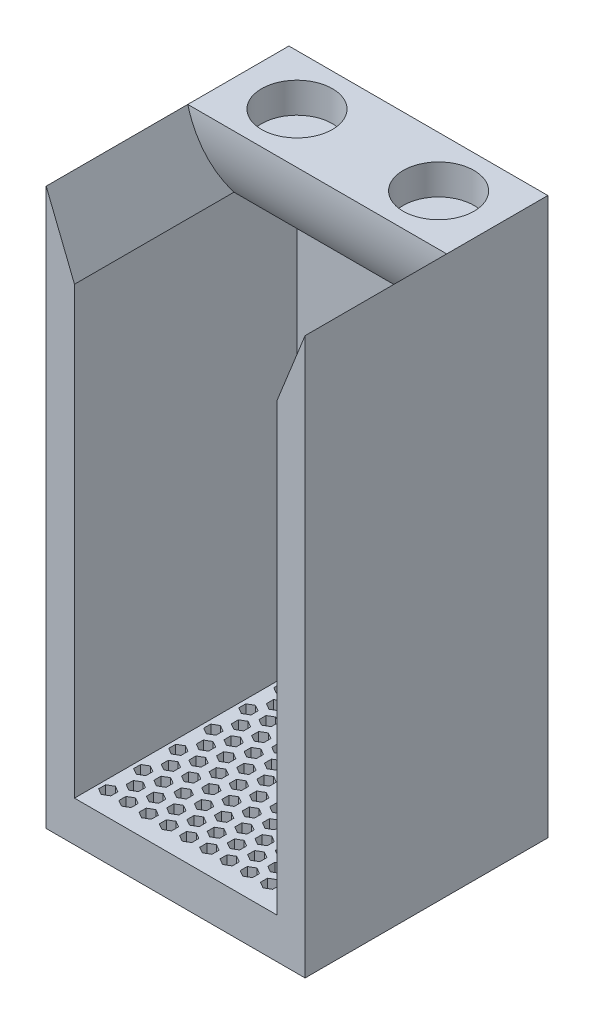
from build123d import *

# Parameters (mm, degrees)
SKETCH1_W               = 12.8
SKETCH1_H               = 27.5
BOSS_EXTRUDE1_DEPTH     = 12
SKETCH2_R               = 1.75
CUT_EXTRUDE1_DEPTH      = 1.5
SKETCH3_W               = 10
SKETCH3_H               = 22
CUT_EXTRUDE2_DEPTH      = 11
CUT_EXTRUDE3_REACH      = 31.703
CUT_EXTRUDE3_END_RADIUS = 5.3
FILL_START              = -18.5
FILL_PATTERN1_DEPTH     = 2


# Read off the part's stored shape, not the designer's step: Fill Pattern1
with BuildPart() as part:
    # Sketch1 → Boss-Extrude1 (new body)
    with BuildSketch(Plane.XY):
        with Locations((-13.5, -4.75)):
            Rectangle(SKETCH1_W, SKETCH1_H)
    extrude(amount=BOSS_EXTRUDE1_DEPTH)

    # Sketch2 → Cut-Extrude1 (cut)
    with BuildSketch(Plane(origin=(0, 9, 0), x_dir=(1, 0, 0), z_dir=(0, 1, 0))):
        with Locations(Location((-17, -2.5, 0), (0, 0, 270))):
            Circle(SKETCH2_R)
        with Locations(Location((-10, -2.5, 0), (0, 0, 270))):
            Circle(SKETCH2_R)
    extrude(amount=-CUT_EXTRUDE1_DEPTH, mode=Mode.SUBTRACT)

    # Sketch3 → Cut-Extrude2 (cut)
    with BuildSketch(Plane.XY.offset(12)):
        with Locations((-13.5, -5.5)):
            Rectangle(SKETCH3_W, SKETCH3_H)
    extrude(amount=-CUT_EXTRUDE2_DEPTH, mode=Mode.SUBTRACT)

    # Cut-Extrude3: up to this cylinder (the profile starts outside it)
    cut_extrude3_end = Plane(origin=(-13.5, 8.47159519, -0.273593496), z_dir=(1, 0, 0)) * Cylinder(CUT_EXTRUDE3_END_RADIUS, 75.006, mode=Mode.PRIVATE)
    # Sketch4 → Cut-Extrude3 (cut, up to the surface)
    with BuildSketch(Plane.XY.offset(12), mode=Mode.PRIVATE) as cut_extrude3_sk1:
        Polygon((-18.5, 5.5), (-19.9, 9), (-7.1, 9), (-8.5, 5.5), align=None)
    cut_extrude3_tool1 = extrude(cut_extrude3_sk1.sketch, amount=-CUT_EXTRUDE3_REACH, mode=Mode.PRIVATE) - cut_extrude3_end
    add(cut_extrude3_tool1.solids().sort_by_distance((-13.5, 7.321637, 12))[0], mode=Mode.SUBTRACT)

    # Fill Pattern1 outline → Fill Pattern1 (cut)
    with BuildSketch(Plane(origin=(0, 0, 0), x_dir=(1, 0, 0), z_dir=(0, 1, 0)).offset(FILL_START)):
        Polygon((-18, -11.180127019), (-17.696891109, -11.005127019), (-17.696891109, -10.655127019), (-18, -10.480127019), (-18.303108891, -10.655127019), (-18.303108891, -11.005127019), align=None)
        Polygon((-13.5, -8.582050808), (-13.196891109, -8.407050808), (-13.196891109, -8.057050808), (-13.5, -7.882050808), (-13.803108891, -8.057050808), (-13.803108891, -8.407050808), align=None)
        Polygon((-10.5, -6.85), (-10.196891109, -6.675), (-10.196891109, -6.325), (-10.5, -6.15), (-10.803108891, -6.325), (-10.803108891, -6.675), align=None)
        Polygon((-15, -9.448076211), (-14.696891109, -9.273076211), (-14.696891109, -8.923076211), (-15, -8.748076211), (-15.303108891, -8.923076211), (-15.303108891, -9.273076211), align=None)
        Polygon((-12, -7.716025404), (-11.696891109, -7.541025404), (-11.696891109, -7.191025404), (-12, -7.016025404), (-12.303108891, -7.191025404), (-12.303108891, -7.541025404), align=None)
        Polygon((-9, -5.983974596), (-8.696891109, -5.808974596), (-8.696891109, -5.458974596), (-9, -5.283974596), (-9.303108891, -5.458974596), (-9.303108891, -5.808974596), align=None)
        Polygon((-16.5, -10.314101615), (-16.196891109, -10.139101615), (-16.196891109, -9.789101615), (-16.5, -9.614101615), (-16.803108891, -9.789101615), (-16.803108891, -10.139101615), align=None)
        Polygon((-17.696891109, -9.273076211), (-17.696891109, -8.923076211), (-18, -8.748076211), (-18.303108891, -8.923076211), (-18.303108891, -9.273076211), (-18, -9.448076211), align=None)
        Polygon((-17.696891109, -7.541025404), (-17.696891109, -7.191025404), (-18, -7.016025404), (-18.303108891, -7.191025404), (-18.303108891, -7.541025404), (-18, -7.716025404), align=None)
        Polygon((-17.696891109, -5.808974596), (-17.696891109, -5.458974596), (-18, -5.283974596), (-18.303108891, -5.458974596), (-18.303108891, -5.808974596), (-18, -5.983974596), align=None)
        Polygon((-17.696891109, -4.076923789), (-17.696891109, -3.726923789), (-18, -3.551923789), (-18.303108891, -3.726923789), (-18.303108891, -4.076923789), (-18, -4.251923789), align=None)
        Polygon((-17.696891109, -2.344872981), (-17.696891109, -1.994872981), (-18, -1.819872981), (-18.303108891, -1.994872981), (-18.303108891, -2.344872981), (-18, -2.519872981), align=None)
        Polygon((-11.5, -8.582050808), (-11.196891109, -8.407050808), (-11.196891109, -8.057050808), (-11.5, -7.882050808), (-11.803108891, -8.057050808), (-11.803108891, -8.407050808), align=None)
        Polygon((-14.5, -10.314101615), (-14.196891109, -10.139101615), (-14.196891109, -9.789101615), (-14.5, -9.614101615), (-14.803108891, -9.789101615), (-14.803108891, -10.139101615), align=None)
        Polygon((-13, -9.448076211), (-12.696891109, -9.273076211), (-12.696891109, -8.923076211), (-13, -8.748076211), (-13.303108891, -8.923076211), (-13.303108891, -9.273076211), align=None)
        Polygon((-10, -7.716025404), (-9.696891109, -7.541025404), (-9.696891109, -7.191025404), (-10, -7.016025404), (-10.303108891, -7.191025404), (-10.303108891, -7.541025404), align=None)
        Polygon((-16, -11.180127019), (-15.696891109, -11.005127019), (-15.696891109, -10.655127019), (-16, -10.480127019), (-16.303108891, -10.655127019), (-16.303108891, -11.005127019), align=None)
        Polygon((-11.196891109, -6.675), (-11.196891109, -6.325), (-11.5, -6.15), (-11.803108891, -6.325), (-11.803108891, -6.675), (-11.5, -6.85), align=None)
        Polygon((-11.196891109, -10.139101615), (-11.196891109, -9.789101615), (-11.5, -9.614101615), (-11.803108891, -9.789101615), (-11.803108891, -10.139101615), (-11.5, -10.314101615), align=None)
        Polygon((-11.196891109, -3.210898385), (-11.196891109, -2.860898385), (-11.5, -2.685898385), (-11.803108891, -2.860898385), (-11.803108891, -3.210898385), (-11.5, -3.385898385), align=None)
        Polygon((-11.196891109, -4.942949192), (-11.196891109, -4.592949192), (-11.5, -4.417949192), (-11.803108891, -4.592949192), (-11.803108891, -4.942949192), (-11.5, -5.117949192), align=None)
        Polygon((-9.696891109, -8.923076211), (-10, -8.748076211), (-10.303108891, -8.923076211), (-10.303108891, -9.273076211), (-10, -9.448076211), (-9.696891109, -9.273076211), align=None)
        Polygon((-14.196891109, -6.325), (-14.5, -6.15), (-14.803108891, -6.325), (-14.803108891, -6.675), (-14.5, -6.85), (-14.196891109, -6.675), align=None)
        Polygon((-12.696891109, -7.191025404), (-13, -7.016025404), (-13.303108891, -7.191025404), (-13.303108891, -7.541025404), (-13, -7.716025404), (-12.696891109, -7.541025404), align=None)
        Polygon((-17.196891109, -4.592949192), (-17.5, -4.417949192), (-17.803108891, -4.592949192), (-17.803108891, -4.942949192), (-17.5, -5.117949192), (-17.196891109, -4.942949192), align=None)
        Polygon((-15.696891109, -5.458974596), (-16, -5.283974596), (-16.303108891, -5.458974596), (-16.303108891, -5.808974596), (-16, -5.983974596), (-15.696891109, -5.808974596), align=None)
        Polygon((-10.5, -8.582050808), (-10.196891109, -8.407050808), (-10.196891109, -8.057050808), (-10.5, -7.882050808), (-10.803108891, -8.057050808), (-10.803108891, -8.407050808), align=None)
        Polygon((-13.5, -10.314101615), (-13.196891109, -10.139101615), (-13.196891109, -9.789101615), (-13.5, -9.614101615), (-13.803108891, -9.789101615), (-13.803108891, -10.139101615), align=None)
        Polygon((-12, -9.448076211), (-11.696891109, -9.273076211), (-11.696891109, -8.923076211), (-12, -8.748076211), (-12.303108891, -8.923076211), (-12.303108891, -9.273076211), align=None)
        Polygon((-15, -11.180127019), (-14.696891109, -11.005127019), (-14.696891109, -10.655127019), (-15, -10.480127019), (-15.303108891, -10.655127019), (-15.303108891, -11.005127019), align=None)
        Polygon((-9, -7.716025404), (-8.696891109, -7.541025404), (-8.696891109, -7.191025404), (-9, -7.016025404), (-9.303108891, -7.191025404), (-9.303108891, -7.541025404), align=None)
        Polygon((-10.196891109, -10.139101615), (-10.196891109, -9.789101615), (-10.5, -9.614101615), (-10.803108891, -9.789101615), (-10.803108891, -10.139101615), (-10.5, -10.314101615), align=None)
        Polygon((-10.196891109, -3.210898385), (-10.196891109, -2.860898385), (-10.5, -2.685898385), (-10.803108891, -2.860898385), (-10.803108891, -3.210898385), (-10.5, -3.385898385), align=None)
        Polygon((-10.196891109, -4.942949192), (-10.196891109, -4.592949192), (-10.5, -4.417949192), (-10.803108891, -4.592949192), (-10.803108891, -4.942949192), (-10.5, -5.117949192), align=None)
        Polygon((-8.696891109, -8.923076211), (-9, -8.748076211), (-9.303108891, -8.923076211), (-9.303108891, -9.273076211), (-9, -9.448076211), (-8.696891109, -9.273076211), align=None)
        Polygon((-13.196891109, -6.325), (-13.5, -6.15), (-13.803108891, -6.325), (-13.803108891, -6.675), (-13.5, -6.85), (-13.196891109, -6.675), align=None)
        Polygon((-14.696891109, -5.458974596), (-15, -5.283974596), (-15.303108891, -5.458974596), (-15.303108891, -5.808974596), (-15, -5.983974596), (-14.696891109, -5.808974596), align=None)
        Polygon((-16.196891109, -4.592949192), (-16.5, -4.417949192), (-16.803108891, -4.592949192), (-16.803108891, -4.942949192), (-16.5, -5.117949192), (-16.196891109, -4.942949192), align=None)
        Polygon((-9.5, -8.582050808), (-9.196891109, -8.407050808), (-9.196891109, -8.057050808), (-9.5, -7.882050808), (-9.803108891, -8.057050808), (-9.803108891, -8.407050808), align=None)
        Polygon((-14, -11.180127019), (-13.696891109, -11.005127019), (-13.696891109, -10.655127019), (-14, -10.480127019), (-14.303108891, -10.655127019), (-14.303108891, -11.005127019), align=None)
        Polygon((-12.5, -10.314101615), (-12.196891109, -10.139101615), (-12.196891109, -9.789101615), (-12.5, -9.614101615), (-12.803108891, -9.789101615), (-12.803108891, -10.139101615), align=None)
        Polygon((-11, -9.448076211), (-10.696891109, -9.273076211), (-10.696891109, -8.923076211), (-11, -8.748076211), (-11.303108891, -8.923076211), (-11.303108891, -9.273076211), align=None)
        Polygon((-9.196891109, -6.675), (-9.196891109, -6.325), (-9.5, -6.15), (-9.803108891, -6.325), (-9.803108891, -6.675), (-9.5, -6.85), align=None)
        Polygon((-9.196891109, -10.139101615), (-9.196891109, -9.789101615), (-9.5, -9.614101615), (-9.803108891, -9.789101615), (-9.803108891, -10.139101615), (-9.5, -10.314101615), align=None)
        Polygon((-9.196891109, -3.210898385), (-9.196891109, -2.860898385), (-9.5, -2.685898385), (-9.803108891, -2.860898385), (-9.803108891, -3.210898385), (-9.5, -3.385898385), align=None)
        Polygon((-9.196891109, -4.942949192), (-9.196891109, -4.592949192), (-9.5, -4.417949192), (-9.803108891, -4.592949192), (-9.803108891, -4.942949192), (-9.5, -5.117949192), align=None)
        Polygon((-12.196891109, -6.325), (-12.5, -6.15), (-12.803108891, -6.325), (-12.803108891, -6.675), (-12.5, -6.85), (-12.196891109, -6.675), align=None)
        Polygon((-10.696891109, -7.191025404), (-11, -7.016025404), (-11.303108891, -7.191025404), (-11.303108891, -7.541025404), (-11, -7.716025404), (-10.696891109, -7.541025404), align=None)
        Polygon((-16.696891109, -3.726923789), (-17, -3.551923789), (-17.303108891, -3.726923789), (-17.303108891, -4.076923789), (-17, -4.251923789), (-16.696891109, -4.076923789), align=None)
        Polygon((-13.696891109, -5.458974596), (-14, -5.283974596), (-14.303108891, -5.458974596), (-14.303108891, -5.808974596), (-14, -5.983974596), (-13.696891109, -5.808974596), align=None)
        Polygon((-15.196891109, -4.592949192), (-15.5, -4.417949192), (-15.803108891, -4.592949192), (-15.803108891, -4.942949192), (-15.5, -5.117949192), (-15.196891109, -4.942949192), align=None)
        Polygon((-13.696891109, -9.273076211), (-13.696891109, -8.923076211), (-14, -8.748076211), (-14.303108891, -8.923076211), (-14.303108891, -9.273076211), (-14, -9.448076211), align=None)
        Polygon((-13.696891109, -7.541025404), (-13.696891109, -7.191025404), (-14, -7.016025404), (-14.303108891, -7.191025404), (-14.303108891, -7.541025404), (-14, -7.716025404), align=None)
        Polygon((-13.696891109, -2.344872981), (-13.696891109, -1.994872981), (-14, -1.819872981), (-14.303108891, -1.994872981), (-14.303108891, -2.344872981), (-14, -2.519872981), align=None)
        Polygon((-13.696891109, -4.076923789), (-13.696891109, -3.726923789), (-14, -3.551923789), (-14.303108891, -3.726923789), (-14.303108891, -4.076923789), (-14, -4.251923789), align=None)
        Polygon((-16.696891109, -8.923076211), (-17, -8.748076211), (-17.303108891, -8.923076211), (-17.303108891, -9.273076211), (-17, -9.448076211), (-16.696891109, -9.273076211), align=None)
        Polygon((-15.196891109, -9.789101615), (-15.5, -9.614101615), (-15.803108891, -9.789101615), (-15.803108891, -10.139101615), (-15.5, -10.314101615), (-15.196891109, -10.139101615), align=None)
        Polygon((-12.5, -8.582050808), (-12.196891109, -8.407050808), (-12.196891109, -8.057050808), (-12.5, -7.882050808), (-12.803108891, -8.057050808), (-12.803108891, -8.407050808), align=None)
        Polygon((-17, -11.180127019), (-16.696891109, -11.005127019), (-16.696891109, -10.655127019), (-17, -10.480127019), (-17.303108891, -10.655127019), (-17.303108891, -11.005127019), align=None)
        Polygon((-12.196891109, -3.210898385), (-12.196891109, -2.860898385), (-12.5, -2.685898385), (-12.803108891, -2.860898385), (-12.803108891, -3.210898385), (-12.5, -3.385898385), align=None)
        Polygon((-12.196891109, -4.942949192), (-12.196891109, -4.592949192), (-12.5, -4.417949192), (-12.803108891, -4.592949192), (-12.803108891, -4.942949192), (-12.5, -5.117949192), align=None)
        Polygon((-15.196891109, -6.325), (-15.5, -6.15), (-15.803108891, -6.325), (-15.803108891, -6.675), (-15.5, -6.85), (-15.196891109, -6.675), align=None)
        Polygon((-16.696891109, -5.458974596), (-17, -5.283974596), (-17.303108891, -5.458974596), (-17.303108891, -5.808974596), (-17, -5.983974596), (-16.696891109, -5.808974596), align=None)
        Polygon((-13.196891109, -3.210898385), (-13.196891109, -2.860898385), (-13.5, -2.685898385), (-13.803108891, -2.860898385), (-13.803108891, -3.210898385), (-13.5, -3.385898385), align=None)
        Polygon((-13.196891109, -4.942949192), (-13.196891109, -4.592949192), (-13.5, -4.417949192), (-13.803108891, -4.592949192), (-13.803108891, -4.942949192), (-13.5, -5.117949192), align=None)
        Polygon((-14.696891109, -7.191025404), (-15, -7.016025404), (-15.303108891, -7.191025404), (-15.303108891, -7.541025404), (-15, -7.716025404), (-14.696891109, -7.541025404), align=None)
        Polygon((-8.696891109, -10.655127019), (-9, -10.480127019), (-9.303108891, -10.655127019), (-9.303108891, -11.005127019), (-9, -11.180127019), (-8.696891109, -11.005127019), align=None)
        Polygon((-16.196891109, -6.325), (-16.5, -6.15), (-16.803108891, -6.325), (-16.803108891, -6.675), (-16.5, -6.85), (-16.196891109, -6.675), align=None)
        Polygon((-14.5, -8.582050808), (-14.196891109, -8.407050808), (-14.196891109, -8.057050808), (-14.5, -7.882050808), (-14.803108891, -8.057050808), (-14.803108891, -8.407050808), align=None)
        Polygon((-17.5, -10.314101615), (-17.196891109, -10.139101615), (-17.196891109, -9.789101615), (-17.5, -9.614101615), (-17.803108891, -9.789101615), (-17.803108891, -10.139101615), align=None)
        Polygon((-16, -9.448076211), (-15.696891109, -9.273076211), (-15.696891109, -8.923076211), (-16, -8.748076211), (-16.303108891, -8.923076211), (-16.303108891, -9.273076211), align=None)
        Polygon((-10, -5.983974596), (-9.696891109, -5.808974596), (-9.696891109, -5.458974596), (-10, -5.283974596), (-10.303108891, -5.458974596), (-10.303108891, -5.808974596), align=None)
        Polygon((-14.196891109, -3.210898385), (-14.196891109, -2.860898385), (-14.5, -2.685898385), (-14.803108891, -2.860898385), (-14.803108891, -3.210898385), (-14.5, -3.385898385), align=None)
        Polygon((-14.196891109, -4.942949192), (-14.196891109, -4.592949192), (-14.5, -4.417949192), (-14.803108891, -4.592949192), (-14.803108891, -4.942949192), (-14.5, -5.117949192), align=None)
        Polygon((-9.696891109, -10.655127019), (-10, -10.480127019), (-10.303108891, -10.655127019), (-10.303108891, -11.005127019), (-10, -11.180127019), (-9.696891109, -11.005127019), align=None)
        Polygon((-17.196891109, -6.325), (-17.5, -6.15), (-17.803108891, -6.325), (-17.803108891, -6.675), (-17.5, -6.85), (-17.196891109, -6.675), align=None)
        Polygon((-15.696891109, -7.191025404), (-16, -7.016025404), (-16.303108891, -7.191025404), (-16.303108891, -7.541025404), (-16, -7.716025404), (-15.696891109, -7.541025404), align=None)
        Polygon((-12.696891109, -10.655127019), (-13, -10.480127019), (-13.303108891, -10.655127019), (-13.303108891, -11.005127019), (-13, -11.180127019), (-12.696891109, -11.005127019), align=None)
        Polygon((-17.196891109, -8.057050808), (-17.5, -7.882050808), (-17.803108891, -8.057050808), (-17.803108891, -8.407050808), (-17.5, -8.582050808), (-17.196891109, -8.407050808), align=None)
        Polygon((-10.696891109, -10.655127019), (-11, -10.480127019), (-11.303108891, -10.655127019), (-11.303108891, -11.005127019), (-11, -11.180127019), (-10.696891109, -11.005127019), align=None)
        Polygon((-16.696891109, -7.191025404), (-17, -7.016025404), (-17.303108891, -7.191025404), (-17.303108891, -7.541025404), (-17, -7.716025404), (-16.696891109, -7.541025404), align=None)
        Polygon((-15.196891109, -8.057050808), (-15.5, -7.882050808), (-15.803108891, -8.057050808), (-15.803108891, -8.407050808), (-15.5, -8.582050808), (-15.196891109, -8.407050808), align=None)
        Polygon((-11.696891109, -10.655127019), (-12, -10.480127019), (-12.303108891, -10.655127019), (-12.303108891, -11.005127019), (-12, -11.180127019), (-11.696891109, -11.005127019), align=None)
        Polygon((-16.196891109, -8.057050808), (-16.5, -7.882050808), (-16.803108891, -8.057050808), (-16.803108891, -8.407050808), (-16.5, -8.582050808), (-16.196891109, -8.407050808), align=None)
        Polygon((-8.696891109, -2.344872981), (-8.696891109, -1.994872981), (-9, -1.819872981), (-9.303108891, -1.994872981), (-9.303108891, -2.344872981), (-9, -2.519872981), align=None)
        Polygon((-8.696891109, -4.076923789), (-8.696891109, -3.726923789), (-9, -3.551923789), (-9.303108891, -3.726923789), (-9.303108891, -4.076923789), (-9, -4.251923789), align=None)
        Polygon((-9.696891109, -2.344872981), (-9.696891109, -1.994872981), (-10, -1.819872981), (-10.303108891, -1.994872981), (-10.303108891, -2.344872981), (-10, -2.519872981), align=None)
        Polygon((-9.696891109, -4.076923789), (-9.696891109, -3.726923789), (-10, -3.551923789), (-10.303108891, -3.726923789), (-10.303108891, -4.076923789), (-10, -4.251923789), align=None)
        Polygon((-10.696891109, -2.344872981), (-10.696891109, -1.994872981), (-11, -1.819872981), (-11.303108891, -1.994872981), (-11.303108891, -2.344872981), (-11, -2.519872981), align=None)
        Polygon((-10.696891109, -5.808974596), (-10.696891109, -5.458974596), (-11, -5.283974596), (-11.303108891, -5.458974596), (-11.303108891, -5.808974596), (-11, -5.983974596), align=None)
        Polygon((-10.696891109, -4.076923789), (-10.696891109, -3.726923789), (-11, -3.551923789), (-11.303108891, -3.726923789), (-11.303108891, -4.076923789), (-11, -4.251923789), align=None)
        Polygon((-11.696891109, -2.344872981), (-11.696891109, -1.994872981), (-12, -1.819872981), (-12.303108891, -1.994872981), (-12.303108891, -2.344872981), (-12, -2.519872981), align=None)
        Polygon((-11.696891109, -5.808974596), (-11.696891109, -5.458974596), (-12, -5.283974596), (-12.303108891, -5.458974596), (-12.303108891, -5.808974596), (-12, -5.983974596), align=None)
        Polygon((-11.696891109, -4.076923789), (-11.696891109, -3.726923789), (-12, -3.551923789), (-12.303108891, -3.726923789), (-12.303108891, -4.076923789), (-12, -4.251923789), align=None)
        Polygon((-12.696891109, -2.344872981), (-12.696891109, -1.994872981), (-13, -1.819872981), (-13.303108891, -1.994872981), (-13.303108891, -2.344872981), (-13, -2.519872981), align=None)
        Polygon((-12.696891109, -5.808974596), (-12.696891109, -5.458974596), (-13, -5.283974596), (-13.303108891, -5.458974596), (-13.303108891, -5.808974596), (-13, -5.983974596), align=None)
        Polygon((-12.696891109, -4.076923789), (-12.696891109, -3.726923789), (-13, -3.551923789), (-13.303108891, -3.726923789), (-13.303108891, -4.076923789), (-13, -4.251923789), align=None)
        Polygon((-17.196891109, -2.860898385), (-17.5, -2.685898385), (-17.803108891, -2.860898385), (-17.803108891, -3.210898385), (-17.5, -3.385898385), (-17.196891109, -3.210898385), align=None)
        Polygon((-15.696891109, -3.726923789), (-16, -3.551923789), (-16.303108891, -3.726923789), (-16.303108891, -4.076923789), (-16, -4.251923789), (-15.696891109, -4.076923789), align=None)
        Polygon((-16.196891109, -2.860898385), (-16.5, -2.685898385), (-16.803108891, -2.860898385), (-16.803108891, -3.210898385), (-16.5, -3.385898385), (-16.196891109, -3.210898385), align=None)
        Polygon((-14.696891109, -3.726923789), (-15, -3.551923789), (-15.303108891, -3.726923789), (-15.303108891, -4.076923789), (-15, -4.251923789), (-14.696891109, -4.076923789), align=None)
        Polygon((-15.196891109, -2.860898385), (-15.5, -2.685898385), (-15.803108891, -2.860898385), (-15.803108891, -3.210898385), (-15.5, -3.385898385), (-15.196891109, -3.210898385), align=None)
        Polygon((-16.696891109, -1.994872981), (-17, -1.819872981), (-17.303108891, -1.994872981), (-17.303108891, -2.344872981), (-17, -2.519872981), (-16.696891109, -2.344872981), align=None)
        Polygon((-14.696891109, -2.344872981), (-14.696891109, -1.994872981), (-15, -1.819872981), (-15.303108891, -1.994872981), (-15.303108891, -2.344872981), (-15, -2.519872981), align=None)
        Polygon((-16, -2.519872981), (-15.696891109, -2.344872981), (-15.696891109, -1.994872981), (-16, -1.819872981), (-16.303108891, -1.994872981), (-16.303108891, -2.344872981), align=None)
    extrude(amount=FILL_PATTERN1_DEPTH, mode=Mode.SUBTRACT)


solid = part.part
